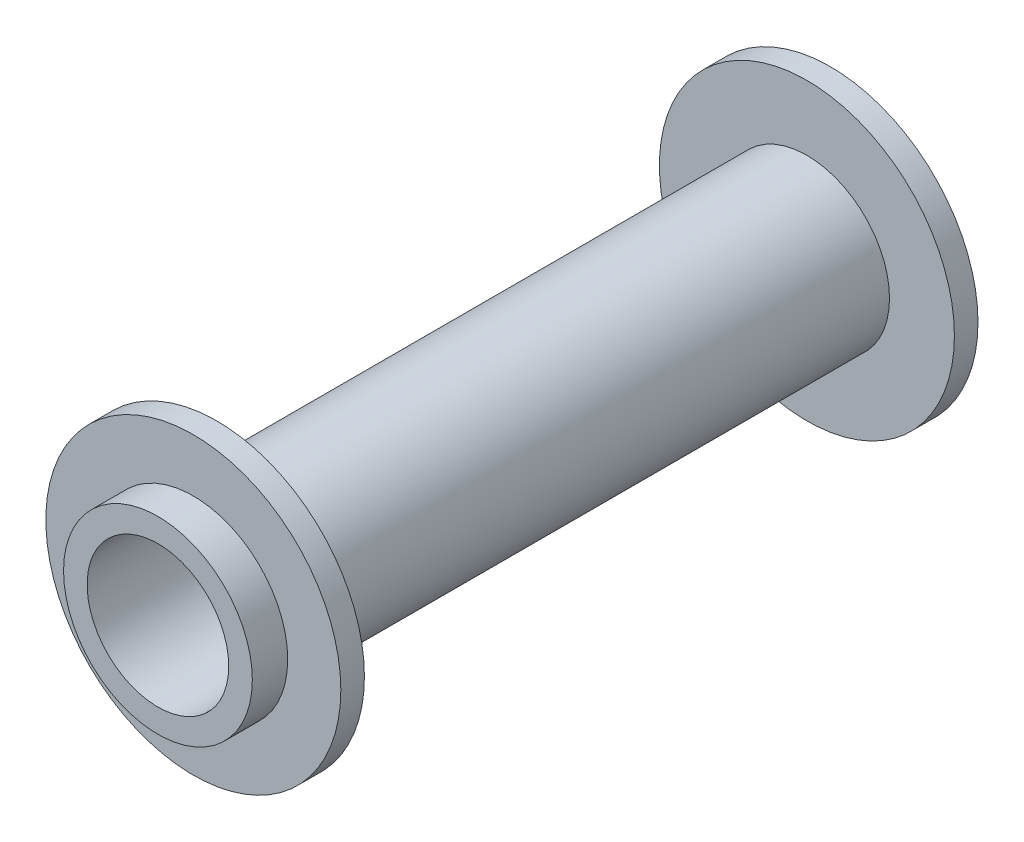
from build123d import *


with BuildPart() as part:
    # Sketch1 → Revolve1 (revolve)
    with BuildSketch(Plane(origin=(0, 0, 0), x_dir=(0, 0, -1), z_dir=(1, 0, 0))):
        Polygon((0, 6), (60, 6), (60, 8), (57, 8), (57, 12.5), (55, 12.5), (55, 7), (5, 7), (5, 12.5), (3, 12.5), (3, 8), (0, 8), align=None)
    revolve(axis=Axis((0, 0, 0), (0, 0, -1)))


solid = part.part
